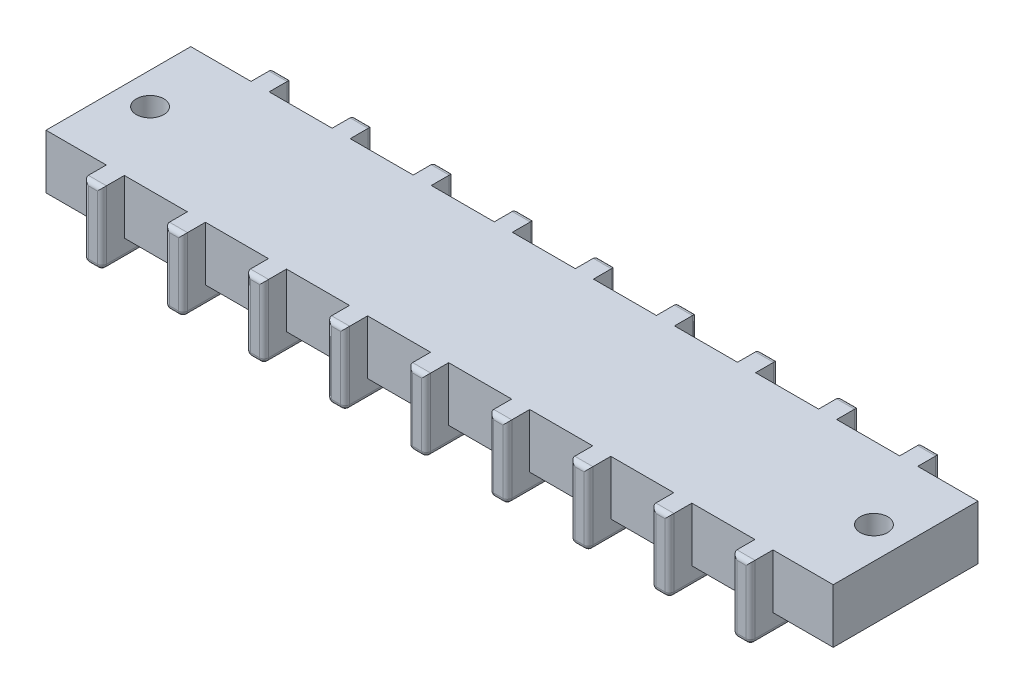
from build123d import *

# Parameters (mm, degrees)
SKETCH1_W               = 138.1125
SKETCH1_H               = 25.4
SKETCH1_R               = 2.413
BOSS_EXTRUDE1_DEPTH     = 9.525
BOSS_EXTRUDE3_START     = -12.7
BOSS_EXTRUDE3_OUTLINE_W = 3.175
BOSS_EXTRUDE3_OUTLINE_H = 33.275671322
BOSS_EXTRUDE3_DEPTH     = 12.7
FILLET1_R               = 0.79375
BOSS_EXTRUDE4_DEPTH     = 0.79375
SKETCH4_R               = 3.96875
BOSS_EXTRUDE5_DEPTH     = 3.175
FILLET2_R               = 1.5875
SKETCH6_W               = 1.5875
SKETCH6_H               = 36.8148236
CUT_EXTRUDE1_DEPTH      = 0.79375


# Read off the part's stored shape, not the designer's step: Boss-Extrude3
with BuildPart() as part:
    # Sketch1 → Boss-Extrude1 (new body)
    with BuildSketch(Plane(origin=(0, 0, 0), x_dir=(1, 0, 0), z_dir=(0, 1, 0))):
        Rectangle(SKETCH1_W, SKETCH1_H)
        with Locations(Location((-63.5, 0, 0), (0, 0, 90))):
            Circle(SKETCH1_R, mode=Mode.SUBTRACT)
        with Locations(Location((63.5, 0, 0), (0, 0, 90))):
            Circle(SKETCH1_R, mode=Mode.SUBTRACT)
    extrude(amount=BOSS_EXTRUDE1_DEPTH)

    # Boss-Extrude3 outline → Boss-Extrude3 (add)
    with BuildSketch(Plane(origin=(0, 9.525, 0), x_dir=(1, 0, 0), z_dir=(0, 1, 0)).offset(BOSS_EXTRUDE3_START)):
        Rectangle(BOSS_EXTRUDE3_OUTLINE_W, BOSS_EXTRUDE3_OUTLINE_H)
        with Locations((-14.224, 0)):
            Rectangle(BOSS_EXTRUDE3_OUTLINE_W, BOSS_EXTRUDE3_OUTLINE_H)
        with Locations((14.224, 0)):
            Rectangle(BOSS_EXTRUDE3_OUTLINE_W, BOSS_EXTRUDE3_OUTLINE_H)
        with Locations((-28.448, 0)):
            Rectangle(BOSS_EXTRUDE3_OUTLINE_W, BOSS_EXTRUDE3_OUTLINE_H)
        with Locations((28.448, 0)):
            Rectangle(BOSS_EXTRUDE3_OUTLINE_W, BOSS_EXTRUDE3_OUTLINE_H)
        with Locations((-42.672, 0)):
            Rectangle(BOSS_EXTRUDE3_OUTLINE_W, BOSS_EXTRUDE3_OUTLINE_H)
        with Locations((42.672, 0)):
            Rectangle(BOSS_EXTRUDE3_OUTLINE_W, BOSS_EXTRUDE3_OUTLINE_H)
        with Locations((-56.896, 0)):
            Rectangle(BOSS_EXTRUDE3_OUTLINE_W, BOSS_EXTRUDE3_OUTLINE_H)
        with Locations((56.896, 0)):
            Rectangle(BOSS_EXTRUDE3_OUTLINE_W, BOSS_EXTRUDE3_OUTLINE_H)
    extrude(amount=BOSS_EXTRUDE3_DEPTH)

    # Fillet1
    fillet1_edges = [part.edges().sort_by_distance(p)[0] for p in [
        (42.672, 9.525, 16.637835661),
        (44.2595, 3.175, 16.637835661),
        (42.672, -3.175, -16.637835661),
        (41.0845, 3.175, -16.637835661),
        (42.672, -3.175, 16.637835661),
        (41.0845, -3.175, 0),
        (55.3085, 3.175, 16.637835661),
        (58.4835, -3.175, 0),
        (58.4835, 3.175, -16.637835661),
        (56.896, 9.525, -16.637835661),
        (56.896, 9.525, 16.637835661),
        (58.4835, 3.175, 16.637835661),
        (56.896, -3.175, -16.637835661),
        (55.3085, 3.175, -16.637835661),
        (56.896, -3.175, 16.637835661),
        (55.3085, -3.175, 0),
        (-14.224, 9.525, 16.637835661),
        (-12.6365, -3.175, 0),
        (-12.6365, 3.175, -16.637835661),
        (-15.8115, 3.175, 16.637835661),
        (-14.224, 9.525, -16.637835661),
        (-15.8115, 3.175, -16.637835661),
        (-14.224, -3.175, 16.637835661),
        (-12.6365, 3.175, 16.637835661),
        (-14.224, -3.175, -16.637835661),
        (-15.8115, -3.175, 0),
        (-28.448, 9.525, 16.637835661),
        (-26.8605, -3.175, 0),
        (-26.8605, 3.175, -16.637835661),
        (-30.0355, 3.175, 16.637835661),
        (-28.448, 9.525, -16.637835661),
        (-30.0355, 3.175, -16.637835661),
        (-28.448, -3.175, 16.637835661),
        (-26.8605, 3.175, 16.637835661),
        (-28.448, -3.175, -16.637835661),
        (-30.0355, -3.175, 0),
        (-42.672, 9.525, 16.637835661),
        (-41.0845, -3.175, 0),
        (-41.0845, 3.175, -16.637835661),
        (-44.2595, 3.175, 16.637835661),
        (-42.672, 9.525, -16.637835661),
        (-44.2595, 3.175, -16.637835661),
        (-42.672, -3.175, 16.637835661),
        (-41.0845, 3.175, 16.637835661),
        (-42.672, -3.175, -16.637835661),
        (-44.2595, -3.175, 0),
        (-56.896, 9.525, 16.637835661),
        (-55.3085, -3.175, 0),
        (-55.3085, 3.175, -16.637835661),
        (-58.4835, 3.175, 16.637835661),
        (-56.896, 9.525, -16.637835661),
        (-58.4835, 3.175, -16.637835661),
        (-56.896, -3.175, 16.637835661),
        (-55.3085, 3.175, 16.637835661),
        (-56.896, -3.175, -16.637835661),
        (-58.4835, -3.175, 0),
        (-1.5875, 3.175, 16.637835661),
        (1.5875, -3.175, 0),
        (1.5875, 3.175, -16.637835661),
        (0, 9.525, -16.637835661),
        (0, -3.175, -16.637835661),
        (-1.5875, 3.175, -16.637835661),
        (0, 9.525, 16.637835661),
        (1.5875, 3.175, 16.637835661),
        (-1.5875, -3.175, 0),
        (0, -3.175, 16.637835661),
        (12.6365, 3.175, 16.637835661),
        (15.8115, -3.175, 0),
        (15.8115, 3.175, -16.637835661),
        (14.224, 9.525, -16.637835661),
        (14.224, 9.525, 16.637835661),
        (15.8115, 3.175, 16.637835661),
        (14.224, -3.175, -16.637835661),
        (12.6365, 3.175, -16.637835661),
        (14.224, -3.175, 16.637835661),
        (12.6365, -3.175, 0),
        (26.8605, 3.175, 16.637835661),
        (30.0355, -3.175, 0),
        (30.0355, 3.175, -16.637835661),
        (28.448, 9.525, -16.637835661),
        (28.448, 9.525, 16.637835661),
        (30.0355, 3.175, 16.637835661),
        (28.448, -3.175, -16.637835661),
        (26.8605, 3.175, -16.637835661),
        (28.448, -3.175, 16.637835661),
        (26.8605, -3.175, 0),
        (41.0845, 3.175, 16.637835661),
        (44.2595, -3.175, 0),
        (44.2595, 3.175, -16.637835661),
        (42.672, 9.525, -16.637835661),
    ]]
    fillet(fillet1_edges, radius=FILLET1_R)

    # Sketch3 → Boss-Extrude4 (add)
    with BuildSketch(Plane(origin=(0, 0, 0), x_dir=(-1, 0, 0), z_dir=(0, -1, 0))):
        with BuildLine():
            Line((41.0845, 9.525), (41.0845, -9.525))
            ThreePointArc((41.0845, -9.525), (35.56, -11.011163665), (30.0355, -9.525))
            Line((30.0355, -9.525), (30.0355, 9.525))
            ThreePointArc((30.0355, 9.525), (35.56, 11.011163665), (41.0845, 9.525))
        make_face()
        with BuildLine():
            Line((44.2595, 9.525), (44.2595, -9.525))
            ThreePointArc((44.2595, -9.525), (49.784, -11.011163665), (55.3085, -9.525))
            Line((55.3085, -9.525), (55.3085, 9.525))
            ThreePointArc((55.3085, 9.525), (49.784, 11.011163665), (44.2595, 9.525))
        make_face()
        with BuildLine():
            Line((26.8605, 9.525), (26.8605, -9.525))
            ThreePointArc((26.8605, -9.525), (21.336, -11.011163665), (15.8115, -9.525))
            Line((15.8115, -9.525), (15.8115, 9.525))
            ThreePointArc((15.8115, 9.525), (21.336, 11.011163665), (26.8605, 9.525))
        make_face()
        with BuildLine():
            Line((12.6365, 9.525), (12.6365, -9.525))
            ThreePointArc((12.6365, -9.525), (7.112, -11.011163665), (1.5875, -9.525))
            Line((1.5875, -9.525), (1.5875, 9.525))
            ThreePointArc((1.5875, 9.525), (7.112, 11.011163665), (12.6365, 9.525))
        make_face()
        with BuildLine():
            Line((-1.5875, 9.525), (-1.5875, -9.525))
            ThreePointArc((-1.5875, -9.525), (-7.112, -11.011163665), (-12.6365, -9.525))
            Line((-12.6365, -9.525), (-12.6365, 9.525))
            ThreePointArc((-12.6365, 9.525), (-7.112, 11.011163665), (-1.5875, 9.525))
        make_face()
        with BuildLine():
            Line((-15.8115, 9.525), (-15.8115, -9.525))
            ThreePointArc((-15.8115, -9.525), (-21.336, -11.011163665), (-26.8605, -9.525))
            Line((-26.8605, -9.525), (-26.8605, 9.525))
            ThreePointArc((-26.8605, 9.525), (-21.336, 11.011163665), (-15.8115, 9.525))
        make_face()
        with BuildLine():
            Line((-30.0355, 9.525), (-30.0355, -9.525))
            ThreePointArc((-30.0355, -9.525), (-35.56, -11.011163665), (-41.0845, -9.525))
            Line((-41.0845, -9.525), (-41.0845, 9.525))
            ThreePointArc((-41.0845, 9.525), (-35.56, 11.011163665), (-30.0355, 9.525))
        make_face()
        with BuildLine():
            Line((-44.2595, 9.525), (-44.2595, -9.525))
            ThreePointArc((-44.2595, -9.525), (-49.784, -11.011163665), (-55.3085, -9.525))
            Line((-55.3085, -9.525), (-55.3085, 9.525))
            ThreePointArc((-55.3085, 9.525), (-49.784, 11.011163665), (-44.2595, 9.525))
        make_face()
    extrude(amount=BOSS_EXTRUDE4_DEPTH)

    # Sketch4 → Boss-Extrude5 (add)
    with BuildSketch(Plane(origin=(0, 0, 0), x_dir=(-1, 0, 0), z_dir=(0, -1, 0))):
        with Locations(Location((49.784, -6.35, 0), (0, 0, 90))):
            Circle(SKETCH4_R)
        with Locations(Location((49.784, 6.35, 0), (0, 0, 270))):
            Circle(SKETCH4_R)
        with Locations(Location((35.56, 6.35, 0), (0, 0, 270))):
            Circle(SKETCH4_R)
        with Locations(Location((35.56, -6.35, 0), (0, 0, 90))):
            Circle(SKETCH4_R)
        with Locations(Location((21.336, 6.35, 0), (0, 0, 270))):
            Circle(SKETCH4_R)
        with Locations(Location((21.336, -6.35, 0), (0, 0, 90))):
            Circle(SKETCH4_R)
        with Locations(Location((7.112, 6.35, 0), (0, 0, 270))):
            Circle(SKETCH4_R)
        with Locations(Location((7.112, -6.35, 0), (0, 0, 90))):
            Circle(SKETCH4_R)
        with Locations(Location((-7.112, 6.35, 0), (0, 0, 270))):
            Circle(SKETCH4_R)
        with Locations(Location((-7.112, -6.35, 0), (0, 0, 90))):
            Circle(SKETCH4_R)
        with Locations(Location((-21.336, 6.35, 0), (0, 0, 270))):
            Circle(SKETCH4_R)
        with Locations(Location((-21.336, -6.35, 0), (0, 0, 90))):
            Circle(SKETCH4_R)
        with Locations(Location((-35.56, 6.35, 0), (0, 0, 270))):
            Circle(SKETCH4_R)
        with Locations(Location((-35.56, -6.35, 0), (0, 0, 90))):
            Circle(SKETCH4_R)
        with Locations(Location((-49.784, 6.35, 0), (0, 0, 270))):
            Circle(SKETCH4_R)
        with Locations(Location((-49.784, -6.35, 0), (0, 0, 90))):
            Circle(SKETCH4_R)
    extrude(amount=BOSS_EXTRUDE5_DEPTH)

    # Fillet2
    fillet2_edges = [part.edges().sort_by_distance(p)[0] for p in [
        (-49.784, -3.175, 10.31875),
        (-49.784, -3.175, -10.31875),
        (-35.56, -3.175, 10.31875),
        (-35.56, -3.175, -10.31875),
        (-21.336, -3.175, 10.31875),
        (-21.336, -3.175, -10.31875),
        (-7.112, -3.175, 10.31875),
        (-7.112, -3.175, -10.31875),
        (7.112, -3.175, 10.31875),
        (7.112, -3.175, -10.31875),
        (21.336, -3.175, 10.31875),
        (21.336, -3.175, -10.31875),
        (35.56, -3.175, 10.31875),
        (35.56, -3.175, -10.31875),
        (49.784, -3.175, 10.31875),
        (49.784, -3.175, -10.31875),
    ]]
    fillet(fillet2_edges, radius=FILLET2_R)

    # Sketch6 → Cut-Extrude1 (cut)
    with BuildSketch(Plane(origin=(0, -3.175, 0), x_dir=(-1, 0, 0), z_dir=(0, -1, 0))):
        with Locations((35.56, 0.79375)):
            Rectangle(SKETCH6_W, SKETCH6_H)
        with Locations((49.784, 0.79375)):
            Rectangle(SKETCH6_W, SKETCH6_H)
        with Locations((21.336, 0.79375)):
            Rectangle(SKETCH6_W, SKETCH6_H)
        with Locations((7.112, 0.79375)):
            Rectangle(SKETCH6_W, SKETCH6_H)
        with Locations((-7.112, 0.79375)):
            Rectangle(SKETCH6_W, SKETCH6_H)
        with Locations((-21.336, 0.79375)):
            Rectangle(SKETCH6_W, SKETCH6_H)
        with Locations((-35.56, 0.79375)):
            Rectangle(SKETCH6_W, SKETCH6_H)
        with Locations((-49.784, 0.79375)):
            Rectangle(SKETCH6_W, SKETCH6_H)
    extrude(amount=-CUT_EXTRUDE1_DEPTH, mode=Mode.SUBTRACT)


solid = part.part
